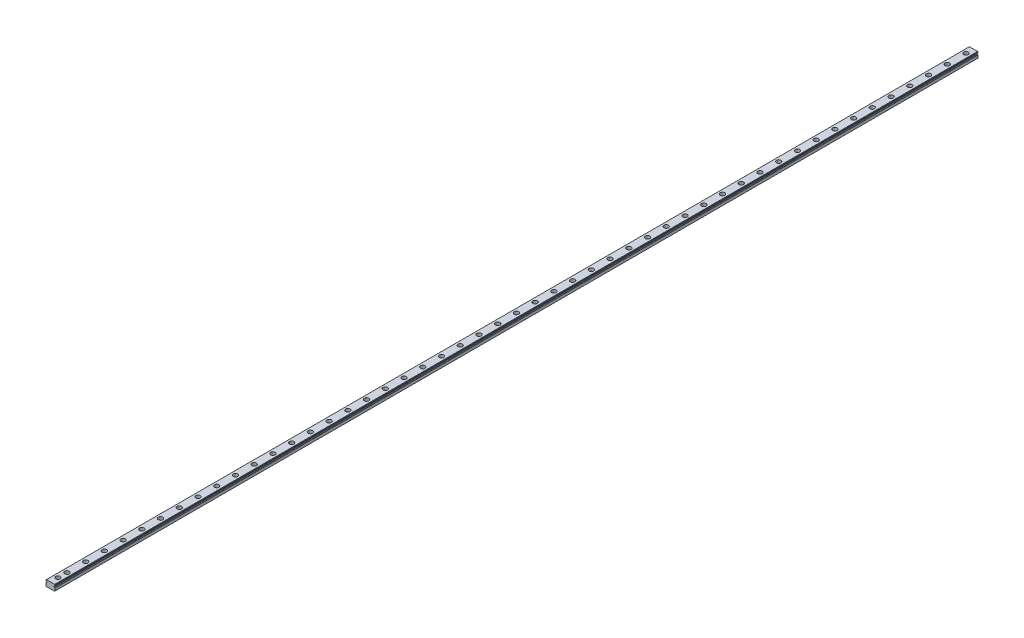
from build123d import *

# Parameters (mm, degrees)
RAIL_PROFILE_DEPTH             = 615.95
CBORE_FOR_M3_SHCS1_D           = 3.5
CBORE_FOR_M3_SHCS1_CBORE_D     = 6
CBORE_FOR_M3_SHCS1_CBORE_DEPTH = 4.5
FILL_START                     = -2.000000001
FILL_PATTERN1_OUTLINE_R        = 3
FILL_PATTERN1_DEPTH            = 4.5
FILL_START_2                   = -5.5
FILL_PATTERN1_2_OUTLINE_R      = 1.75
FILL_PATTERN1_2_DEPTH          = 3.499999999


# Read off the part's stored shape, not the designer's step: Fill Pattern1
with BuildPart() as part:
    # Sketch1 → RAIL PROFILE (new, symmetric)
    with BuildSketch(Plane.XY):
        with BuildLine():
            Line((-5.982334879, -1.370069213), (-5.982334879, -5.001472146))
            Line((-5.982334879, -5.001472146), (-5.483807025, -5.499999999))
            Line((-5.483807025, -5.499999999), (1.595289228, -5.499999999))
            ThreePointArc((1.595289228, -5.499999999), (1.994111552, -5.300588838), (2.392933875, -5.5))
            Line((2.392933875, -5.5), (5.483807024, -5.5))
            Line((5.483807024, -5.5), (5.982334878, -5.001472147))
            Line((5.982334878, -5.001472147), (5.982334878, -1.370069213))
            ThreePointArc((5.982334878, -1.370069213), (5.940056641, -1.231182813), (5.82756375, -1.139410101))
            ThreePointArc((5.82756375, -1.139410101), (5.497041405, -0.930122348), (5.251697363, -0.625405104))
            ThreePointArc((5.251697363, -0.625405104), (5.169975597, -0.541388466), (5.058890009, -0.504008866))
            Line((5.058890009, -0.504008866), (4.71429032, -0.473860299))
            ThreePointArc((4.71429032, -0.473860299), (4.552238438, -0.393945155), (4.486751147, -0.225544865))
            Line((4.486751147, -0.225544865), (4.486751147, 0.225544865))
            ThreePointArc((4.486751147, 0.225544865), (4.552238438, 0.393945155), (4.71429032, 0.473860299))
            Line((4.71429032, 0.473860299), (5.079776582, 0.505836204))
            ThreePointArc((5.079776582, 0.505836204), (5.187925163, 0.5413949), (5.268982803, 0.621333598))
            ThreePointArc((5.268982803, 0.621333598), (5.511607978, 0.899707672), (5.82756375, 1.09083865))
            ThreePointArc((5.82756375, 1.09083865), (5.940040963, 1.182638806), (5.982312115, 1.321532803))
            Line((5.982312115, 1.321532803), (5.982321902, 2.00145917))
            Line((5.982321902, 2.00145917), (5.483807025, 2.499999999))
            Line((5.483807025, 2.499999999), (-5.483807026, 2.499999999))
            Line((-5.483807026, 2.499999999), (-5.982321903, 2.00145917))
            Line((-5.982321903, 2.00145917), (-5.982321903, 1.32884687))
            ThreePointArc((-5.982321903, 1.32884687), (-5.942177076, 1.185718341), (-5.827697321, 1.090893402))
            ThreePointArc((-5.827697321, 1.090893402), (-5.511663234, 0.899754111), (-5.268982805, 0.621333597))
            ThreePointArc((-5.268982805, 0.621333597), (-5.187925164, 0.541394898), (-5.079776582, 0.505836204))
            Line((-5.079776582, 0.505836204), (-4.71429032, 0.473860299))
            ThreePointArc((-4.71429032, 0.473860299), (-4.552238438, 0.393945155), (-4.486751147, 0.225544865))
            Line((-4.486751147, 0.225544865), (-4.486751147, -0.225544865))
            ThreePointArc((-4.486751147, -0.225544865), (-4.552238438, -0.393945155), (-4.71429032, -0.473860299))
            Line((-4.71429032, -0.473860299), (-5.058890009, -0.504008866))
            ThreePointArc((-5.058890009, -0.504008866), (-5.169975597, -0.541388466), (-5.251697363, -0.625405104))
            ThreePointArc((-5.251697363, -0.625405104), (-5.499180752, -0.921502608), (-5.828043428, -1.123421157))
            ThreePointArc((-5.828043428, -1.123421157), (-5.944906256, -1.221900029), (-5.982334879, -1.370069213))
        make_face()
    extrude(amount=RAIL_PROFILE_DEPTH, both=True)

    # CBORE for M3 SHCS1 (through all)
    with Locations(Plane(origin=(0, 2.499999999, 0), x_dir=(1, 0, 0), z_dir=(0, 1, 0))):
        with Locations((0, 605.95)):
            cbore_for_m3_shcs1 = CounterBoreHole(CBORE_FOR_M3_SHCS1_D / 2, CBORE_FOR_M3_SHCS1_CBORE_D / 2, CBORE_FOR_M3_SHCS1_CBORE_DEPTH)

    # M3 END MIRROR: CBORE for M3 SHCS1 across plane
    add(cbore_for_m3_shcs1.mirror(Plane.XY), mode=Mode.SUBTRACT)

    # Fill Pattern1 outline → Fill Pattern1 (cut)
    with BuildSketch(Plane(origin=(0, 0, 0), x_dir=(1, 0, 0), z_dir=(0, 1, 0)).offset(FILL_START)):
        with Locations((0, 580.95)):
            Circle(FILL_PATTERN1_OUTLINE_R)
        with Locations((0, 555.95)):
            Circle(FILL_PATTERN1_OUTLINE_R)
        with Locations((0, 530.95)):
            Circle(FILL_PATTERN1_OUTLINE_R)
        with Locations((0, 505.95)):
            Circle(FILL_PATTERN1_OUTLINE_R)
        with Locations((0, 480.95)):
            Circle(FILL_PATTERN1_OUTLINE_R)
        with Locations((0, 455.95)):
            Circle(FILL_PATTERN1_OUTLINE_R)
        with Locations((0, 430.95)):
            Circle(FILL_PATTERN1_OUTLINE_R)
        with Locations((0, 405.95)):
            Circle(FILL_PATTERN1_OUTLINE_R)
        with Locations((0, 380.95)):
            Circle(FILL_PATTERN1_OUTLINE_R)
        with Locations((0, 355.95)):
            Circle(FILL_PATTERN1_OUTLINE_R)
        with Locations((0, 330.95)):
            Circle(FILL_PATTERN1_OUTLINE_R)
        with Locations((0, 305.95)):
            Circle(FILL_PATTERN1_OUTLINE_R)
        with Locations((0, 280.95)):
            Circle(FILL_PATTERN1_OUTLINE_R)
        with Locations((0, 255.95)):
            Circle(FILL_PATTERN1_OUTLINE_R)
        with Locations((0, 230.95)):
            Circle(FILL_PATTERN1_OUTLINE_R)
        with Locations((0, 205.95)):
            Circle(FILL_PATTERN1_OUTLINE_R)
        with Locations((0, 180.95)):
            Circle(FILL_PATTERN1_OUTLINE_R)
        with Locations((0, 155.95)):
            Circle(FILL_PATTERN1_OUTLINE_R)
        with Locations((0, 130.95)):
            Circle(FILL_PATTERN1_OUTLINE_R)
        with Locations((0, 105.95)):
            Circle(FILL_PATTERN1_OUTLINE_R)
        with Locations((0, 80.95)):
            Circle(FILL_PATTERN1_OUTLINE_R)
        with Locations((0, 55.95)):
            Circle(FILL_PATTERN1_OUTLINE_R)
        with Locations((0, 30.95)):
            Circle(FILL_PATTERN1_OUTLINE_R)
        with Locations((0, 5.95)):
            Circle(FILL_PATTERN1_OUTLINE_R)
        with Locations((0, -19.05)):
            Circle(FILL_PATTERN1_OUTLINE_R)
        with Locations((0, -44.05)):
            Circle(FILL_PATTERN1_OUTLINE_R)
        with Locations((0, -69.05)):
            Circle(FILL_PATTERN1_OUTLINE_R)
        with Locations((0, -94.05)):
            Circle(FILL_PATTERN1_OUTLINE_R)
        with Locations((0, -119.05)):
            Circle(FILL_PATTERN1_OUTLINE_R)
        with Locations((0, -144.05)):
            Circle(FILL_PATTERN1_OUTLINE_R)
        with Locations((0, -169.05)):
            Circle(FILL_PATTERN1_OUTLINE_R)
        with Locations((0, -194.05)):
            Circle(FILL_PATTERN1_OUTLINE_R)
        with Locations((0, -219.05)):
            Circle(FILL_PATTERN1_OUTLINE_R)
        with Locations((0, -244.05)):
            Circle(FILL_PATTERN1_OUTLINE_R)
        with Locations((0, -269.05)):
            Circle(FILL_PATTERN1_OUTLINE_R)
        with Locations((0, -294.05)):
            Circle(FILL_PATTERN1_OUTLINE_R)
        with Locations((0, -319.05)):
            Circle(FILL_PATTERN1_OUTLINE_R)
        with Locations((0, -344.05)):
            Circle(FILL_PATTERN1_OUTLINE_R)
        with Locations((0, -369.05)):
            Circle(FILL_PATTERN1_OUTLINE_R)
        with Locations((0, -394.05)):
            Circle(FILL_PATTERN1_OUTLINE_R)
        with Locations((0, -419.05)):
            Circle(FILL_PATTERN1_OUTLINE_R)
        with Locations((0, -444.05)):
            Circle(FILL_PATTERN1_OUTLINE_R)
        with Locations((0, -469.05)):
            Circle(FILL_PATTERN1_OUTLINE_R)
        with Locations((0, -494.05)):
            Circle(FILL_PATTERN1_OUTLINE_R)
        with Locations((0, -519.05)):
            Circle(FILL_PATTERN1_OUTLINE_R)
        with Locations((0, -544.05)):
            Circle(FILL_PATTERN1_OUTLINE_R)
        with Locations((0, -569.05)):
            Circle(FILL_PATTERN1_OUTLINE_R)
        with Locations((0, -594.05)):
            Circle(FILL_PATTERN1_OUTLINE_R)
    extrude(amount=FILL_PATTERN1_DEPTH, mode=Mode.SUBTRACT)

    # Fill Pattern1 2 outline → Fill Pattern1 2 (cut)
    with BuildSketch(Plane(origin=(0, 0, 0), x_dir=(1, 0, 0), z_dir=(0, 1, 0)).offset(FILL_START_2)):
        with Locations((0, 580.95)):
            Circle(FILL_PATTERN1_2_OUTLINE_R)
        with Locations((0, 555.95)):
            Circle(FILL_PATTERN1_2_OUTLINE_R)
        with Locations((0, 530.95)):
            Circle(FILL_PATTERN1_2_OUTLINE_R)
        with Locations((0, 505.95)):
            Circle(FILL_PATTERN1_2_OUTLINE_R)
        with Locations((0, 480.95)):
            Circle(FILL_PATTERN1_2_OUTLINE_R)
        with Locations((0, 455.95)):
            Circle(FILL_PATTERN1_2_OUTLINE_R)
        with Locations((0, 430.95)):
            Circle(FILL_PATTERN1_2_OUTLINE_R)
        with Locations((0, 405.95)):
            Circle(FILL_PATTERN1_2_OUTLINE_R)
        with Locations((0, 380.95)):
            Circle(FILL_PATTERN1_2_OUTLINE_R)
        with Locations((0, 355.95)):
            Circle(FILL_PATTERN1_2_OUTLINE_R)
        with Locations((0, 330.95)):
            Circle(FILL_PATTERN1_2_OUTLINE_R)
        with Locations((0, 305.95)):
            Circle(FILL_PATTERN1_2_OUTLINE_R)
        with Locations((0, 280.95)):
            Circle(FILL_PATTERN1_2_OUTLINE_R)
        with Locations((0, 255.95)):
            Circle(FILL_PATTERN1_2_OUTLINE_R)
        with Locations((0, 230.95)):
            Circle(FILL_PATTERN1_2_OUTLINE_R)
        with Locations((0, 205.95)):
            Circle(FILL_PATTERN1_2_OUTLINE_R)
        with Locations((0, 180.95)):
            Circle(FILL_PATTERN1_2_OUTLINE_R)
        with Locations((0, 155.95)):
            Circle(FILL_PATTERN1_2_OUTLINE_R)
        with Locations((0, 130.95)):
            Circle(FILL_PATTERN1_2_OUTLINE_R)
        with Locations((0, 105.95)):
            Circle(FILL_PATTERN1_2_OUTLINE_R)
        with Locations((0, 80.95)):
            Circle(FILL_PATTERN1_2_OUTLINE_R)
        with Locations((0, 55.95)):
            Circle(FILL_PATTERN1_2_OUTLINE_R)
        with Locations((0, 30.95)):
            Circle(FILL_PATTERN1_2_OUTLINE_R)
        with Locations((0, 5.95)):
            Circle(FILL_PATTERN1_2_OUTLINE_R)
        with Locations((0, -19.05)):
            Circle(FILL_PATTERN1_2_OUTLINE_R)
        with Locations((0, -44.05)):
            Circle(FILL_PATTERN1_2_OUTLINE_R)
        with Locations((0, -69.05)):
            Circle(FILL_PATTERN1_2_OUTLINE_R)
        with Locations((0, -94.05)):
            Circle(FILL_PATTERN1_2_OUTLINE_R)
        with Locations((0, -119.05)):
            Circle(FILL_PATTERN1_2_OUTLINE_R)
        with Locations((0, -144.05)):
            Circle(FILL_PATTERN1_2_OUTLINE_R)
        with Locations((0, -169.05)):
            Circle(FILL_PATTERN1_2_OUTLINE_R)
        with Locations((0, -194.05)):
            Circle(FILL_PATTERN1_2_OUTLINE_R)
        with Locations((0, -219.05)):
            Circle(FILL_PATTERN1_2_OUTLINE_R)
        with Locations((0, -244.05)):
            Circle(FILL_PATTERN1_2_OUTLINE_R)
        with Locations((0, -269.05)):
            Circle(FILL_PATTERN1_2_OUTLINE_R)
        with Locations((0, -294.05)):
            Circle(FILL_PATTERN1_2_OUTLINE_R)
        with Locations((0, -319.05)):
            Circle(FILL_PATTERN1_2_OUTLINE_R)
        with Locations((0, -344.05)):
            Circle(FILL_PATTERN1_2_OUTLINE_R)
        with Locations((0, -369.05)):
            Circle(FILL_PATTERN1_2_OUTLINE_R)
        with Locations((0, -394.05)):
            Circle(FILL_PATTERN1_2_OUTLINE_R)
        with Locations((0, -419.05)):
            Circle(FILL_PATTERN1_2_OUTLINE_R)
        with Locations((0, -444.05)):
            Circle(FILL_PATTERN1_2_OUTLINE_R)
        with Locations((0, -469.05)):
            Circle(FILL_PATTERN1_2_OUTLINE_R)
        with Locations((0, -494.05)):
            Circle(FILL_PATTERN1_2_OUTLINE_R)
        with Locations((0, -519.05)):
            Circle(FILL_PATTERN1_2_OUTLINE_R)
        with Locations((0, -544.05)):
            Circle(FILL_PATTERN1_2_OUTLINE_R)
        with Locations((0, -569.05)):
            Circle(FILL_PATTERN1_2_OUTLINE_R)
        with Locations((0, -594.05)):
            Circle(FILL_PATTERN1_2_OUTLINE_R)
    extrude(amount=FILL_PATTERN1_2_DEPTH, mode=Mode.SUBTRACT)


solid = part.part
